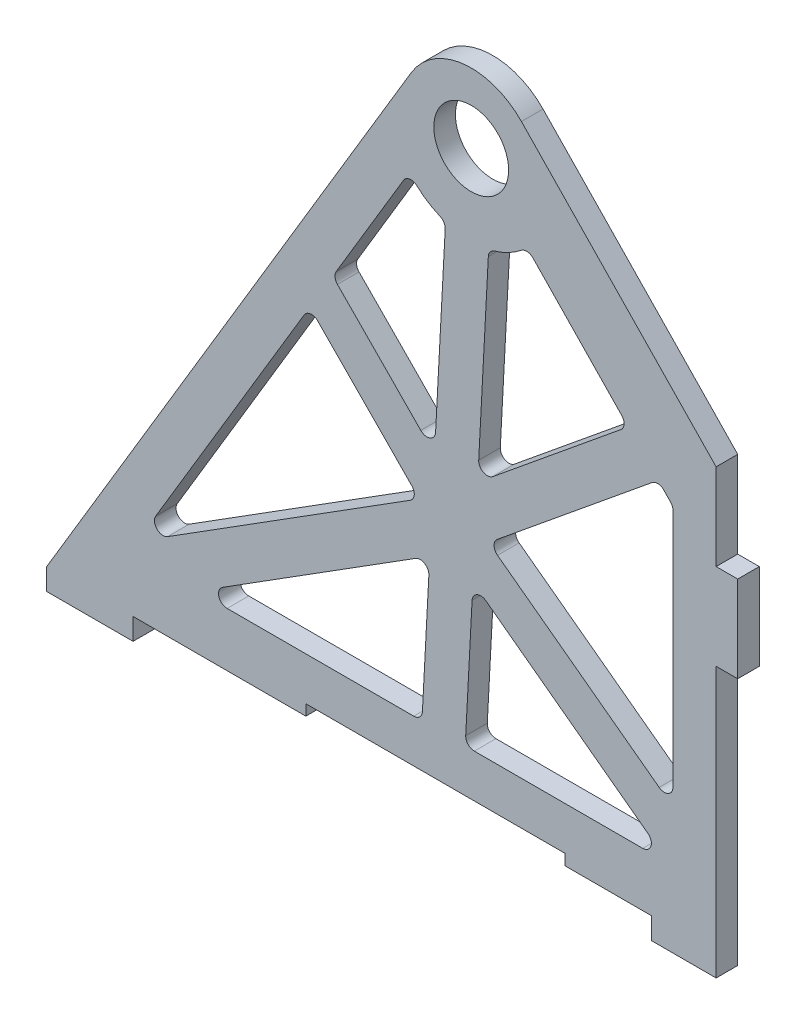
from build123d import *

# Parameters (mm, degrees)
SKETCH2_R           = 11
BOSS_EXTRUDE1_DEPTH = 6.35
CUT_EXTRUDE1_DEPTH  = 1781.261525592
FILLET1_R           = 2.54


with BuildPart() as part:
    # Sketch2 → Boss-Extrude1 (new body)
    with BuildSketch(Plane.XY):
        with BuildLine():
            Line((1592.072, 2.542062626), (1642.872, 2.542062626))
            Line((1642.872, 2.542062626), (1642.872, 5.717062626))
            Line((1642.872, 5.717062626), (1719.072, 5.717062626))
            Line((1719.072, 5.717062626), (1719.072, 2.542062626))
            Line((1719.072, 2.542062626), (1744.472, 2.542062626))
            Line((1744.472, 2.542062626), (1744.472, -3.807937374))
            Line((1744.472, -3.807937374), (1763.522, -3.807937374))
            Line((1763.522, -3.807937374), (1763.522, 75.567062626))
            Line((1763.522, 75.567062626), (1769.872, 75.567062626))
            Line((1769.872, 75.567062626), (1769.872, 100.967062626))
            Line((1769.872, 100.967062626), (1763.522, 100.967062626))
            Line((1763.522, 100.967062626), (1763.522, 126.367062626))
            Line((1763.522, 126.367062626), (1706.27279231, 185.677129722))
            ThreePointArc((1706.27279231, 185.677129722), (1689.15944282, 191.813120822), (1673.886428724, 181.951469947))
            Line((1673.886428724, 181.951469947), (1566.672, 2.542062626))
            Line((1566.672, 2.542062626), (1566.672, -3.807937374))
            Line((1566.672, -3.807937374), (1592.072, -3.807937374))
            Line((1592.072, -3.807937374), (1592.072, 2.542062626))
        make_face()
        with Locations((1691.505126, 171.422598626)):
            Circle(SKETCH2_R, mode=Mode.SUBTRACT)
    extrude(amount=BOSS_EXTRUDE1_DEPTH)

    # Sketch4 → Cut-Extrude1 (cut, through all)
    with BuildSketch(Plane.XY.offset(6.35)):
        with BuildLine():
            ThreePointArc((1683.953755863, 148.957808196), (1678.12887674, 151.858193301), (1673.312329252, 156.23338711))
            Line((1673.312329252, 156.23338711), (1650.793308757, 118.550734051))
            Line((1650.793308757, 118.550734051), (1680.724337509, 88.117212904))
            Line((1680.724337509, 88.117212904), (1683.953755863, 148.957808196))
        make_face()
        Polygon((1676.244439853, 74.560417264), (1644.060655462, 107.284514086), (1593.27487146, 22.301107315), align=None)
        with BuildLine():
            ThreePointArc((1707.964682003, 154.370530828), (1702.720968896, 150.544503212), (1696.635902547, 148.284639943))
            Line((1696.635902547, 148.284639943), (1693.404343424, 87.403713653))
            Line((1693.404343424, 87.403713653), (1737.662029882, 123.604136561))
            Line((1737.662029882, 123.604136561), (1707.964682003, 154.370530828))
        make_face()
        Polygon((1679.310561373, 61.482391308), (1610.937830527, 18.417062626), (1677.024654041, 18.417062626), align=None)
        Polygon((1750.822, 109.970433281), (1746.511961088, 114.435625157), (1696.6239735, 73.629916742), (1750.822, 33.34550852), align=None)
        Polygon((1692.015129519, 61.231631978), (1689.742532491, 18.417062626), (1749.617196094, 18.417062626), align=None)
    extrude(amount=-CUT_EXTRUDE1_DEPTH, mode=Mode.SUBTRACT)

    # Fillet1
    fillet1_edges = [part.edges().sort_by_distance(p)[0] for p in [
        (1673.312329252, 156.23338711, 3.175),
        (1593.27487146, 22.301107315, 3.175),
        (1707.964682003, 154.370530828, 3.175),
        (1750.822, 109.970433281, 3.175),
        (1746.511961088, 114.435625157, 3.175),
        (1750.822, 33.34550852, 3.175),
        (1696.6239735, 73.629916742, 3.175),
        (1737.662029882, 123.604136561, 3.175),
        (1693.404343424, 87.403713653, 3.175),
        (1696.635902547, 148.284639943, 3.175),
        (1677.024654041, 18.417062626, 3.175),
        (1610.937830527, 18.417062626, 3.175),
        (1679.310561373, 61.482391308, 3.175),
        (1644.060655462, 107.284514086, 3.175),
        (1676.244439853, 74.560417264, 3.175),
        (1683.953755863, 148.957808196, 3.175),
        (1650.793308757, 118.550734051, 3.175),
        (1749.617196094, 18.417062626, 3.175),
        (1689.742532491, 18.417062626, 3.175),
        (1692.015129519, 61.231631978, 3.175),
        (1680.724337509, 88.117212904, 3.175),
    ]]
    fillet(fillet1_edges, radius=FILLET1_R)


solid = part.part
